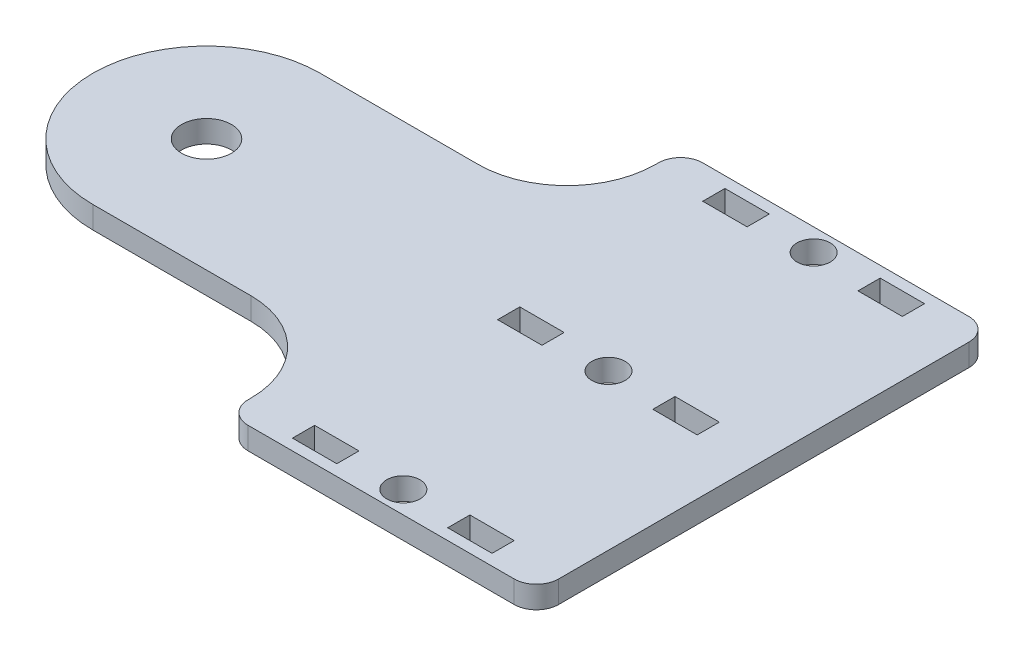
from build123d import *

# Parameters (mm, degrees)
SKETCH1_R           = 2.25
BOSS_EXTRUDE1_DEPTH = 2
FILLET1_R           = 10.25
FILLET2_R           = 2
SKETCH2_R           = 1.5
SKETCH2_W           = 4
SKETCH2_H           = 2
CUT_EXTRUDE1_DEPTH  = 2
FILLET3_R           = 8


with BuildPart() as part:
    # Sketch1 → Boss-Extrude1 (new body)
    with BuildSketch(Plane(origin=(0, 0, 0), x_dir=(1, 0, 0), z_dir=(0, 1, 0))):
        Polygon((0, 0), (32.5, 0), (32.5, -10.25), (60.5, -10.25), (60.5, -0.75), (60.5, 21.25), (60.5, 30.75), (32.5, 30.75), (32.5, 20.5), (0, 20.5), align=None)
        with Locations(Location((10.25, 10.25, 0), (0, 0, 270))):
            Circle(SKETCH1_R, mode=Mode.SUBTRACT)
    extrude(amount=BOSS_EXTRUDE1_DEPTH)

    # Fillet1
    fillet1_edges = [part.edges().sort_by_distance(p)[0] for p in [
        (0, 1, -20.5),
        (0, 1, 0),
    ]]
    fillet(fillet1_edges, radius=FILLET1_R - 0.0001)  # a hair under: the kernel refuses the full size

    # Fillet2
    fillet2_edges = [part.edges().sort_by_distance(p)[0] for p in [
        (32.5, 1, -30.75),
        (60.5, 1, -30.75),
        (60.5, 1, 10.25),
        (32.5, 1, 10.25),
    ]]
    fillet(fillet2_edges, radius=FILLET2_R)

    # Sketch2 → Cut-Extrude1 (cut)
    with BuildSketch(Plane(origin=(0, 2, 0), x_dir=(1, 0, 0), z_dir=(0, 1, 0))):
        with Locations(Location((46.5, 28.75, 0), (0, 0, 270))):
            Circle(SKETCH2_R)
        with Locations(Location((46.5, 10.25, 0), (0, 0, 270))):
            Circle(SKETCH2_R)
        with Locations(Location((46.5, -8.25, 0), (0, 0, 270))):
            Circle(SKETCH2_R)
        with Locations((39.5, 28.75)):
            Rectangle(SKETCH2_W, SKETCH2_H)
        with Locations((53.5, 28.75)):
            Rectangle(SKETCH2_W, SKETCH2_H)
        with Locations((39.5, 10.25)):
            Rectangle(SKETCH2_W, SKETCH2_H)
        with Locations((53.5, 10.25)):
            Rectangle(SKETCH2_W, SKETCH2_H)
        with Locations((39.5, -8.25)):
            Rectangle(SKETCH2_W, SKETCH2_H)
        with Locations((53.5, -8.25)):
            Rectangle(SKETCH2_W, SKETCH2_H)
    extrude(amount=-CUT_EXTRUDE1_DEPTH, mode=Mode.SUBTRACT)

    # Fillet3
    fillet3_edges = [part.edges().sort_by_distance(p)[0] for p in [
        (32.5, 1, -20.5),
        (32.5, 1, 0),
    ]]
    fillet(fillet3_edges, radius=FILLET3_R)


solid = part.part
